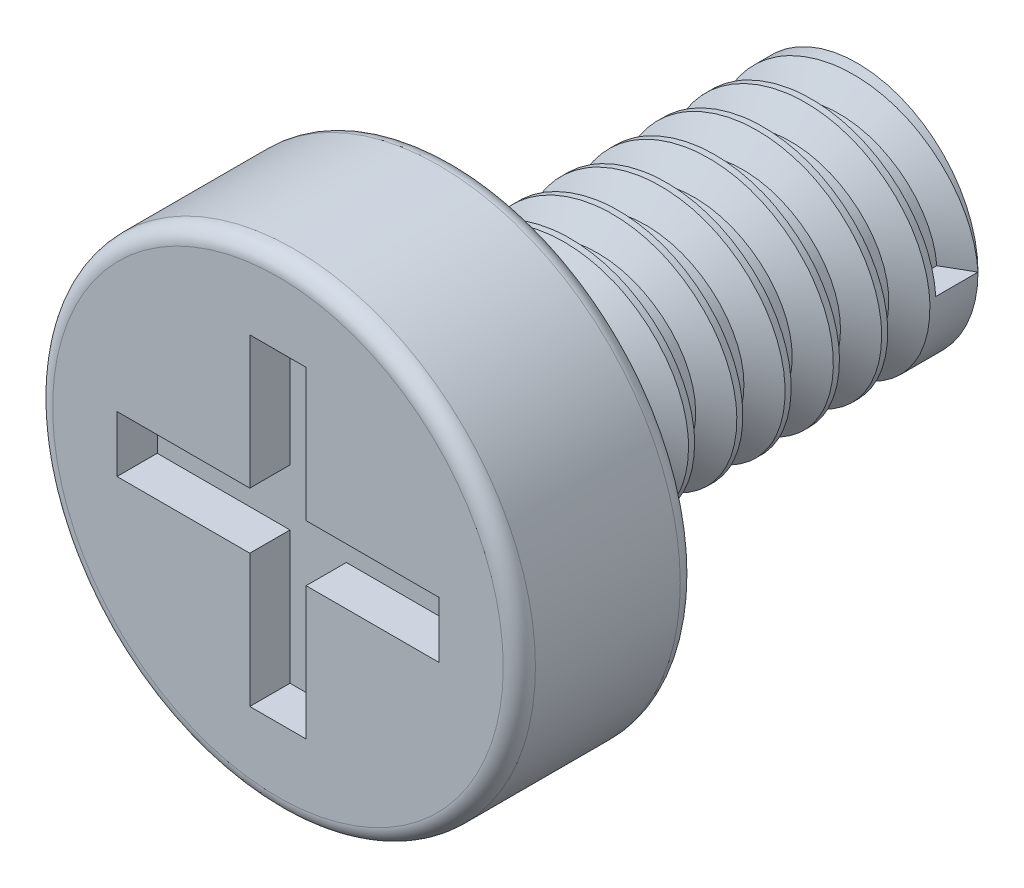
from build123d import *

# Parameters (mm, degrees)
SKETCH1_R           = 1.5
BOSS_EXTRUDE1_DEPTH = 5
SKETCH2_R           = 3
BOSS_EXTRUDE2_DEPTH = 2.2
SKETCH7_W           = 0.7
SKETCH7_H           = 1.65
SKETCH7_W_2         = 1.65
SKETCH7_H_2         = 0.7
CUT_EXTRUDE1_DEPTH  = 0.5
FILLET1_R           = 0.2
THREAD1_PITCH       = 0.6


with BuildPart() as part:
    # Sketch1 → Boss-Extrude1 (new body)
    with BuildSketch(Plane.XY):
        Circle(SKETCH1_R)
    extrude(amount=BOSS_EXTRUDE1_DEPTH)

    # Sketch2 → Boss-Extrude2 (add)
    with BuildSketch(Plane.XY.offset(5)):
        Circle(SKETCH2_R)
    extrude(amount=BOSS_EXTRUDE2_DEPTH)

    # Sketch7 → Cut-Extrude1 (cut)
    with BuildSketch(Plane.XY.offset(7.2)):
        with Locations((0, 1.175)):
            Rectangle(SKETCH7_W, SKETCH7_H)
        with Locations((1.175, 0)):
            Rectangle(SKETCH7_W_2, SKETCH7_H_2)
        with Locations((0, -1.175)):
            Rectangle(SKETCH7_W, SKETCH7_H)
        with Locations((-1.175, 0)):
            Rectangle(SKETCH7_W_2, SKETCH7_H_2)
        Rectangle(SKETCH7_W, SKETCH7_H_2)
    extrude(amount=-CUT_EXTRUDE1_DEPTH, mode=Mode.SUBTRACT)

    # Fillet1
    fillet1_edges = [part.edges().sort_by_distance(p)[0] for p in [
        (-3, 0, 5),
        (-3, 0, 7.2),
    ]]
    fillet(fillet1_edges, radius=FILLET1_R)

    # Thread1: the profile of Thread Profile1 profile screwed along a right-hand helix of 8.333333 turns, 6 arcs to a turn; built about Z, then put on its axis
    thread1_z = Axis((0, 0, 0), (0, 0, 1))
    thread1_corners = [(1.5003, 0, -0.000173205), (1.5003, 0, 0.525173203), (1.175240475, 0, 0.337499999), (1.175240475, 0, 0.187499999)]
    with BuildLine(mode=Mode.PRIVATE) as thread1_profile:
        Line(thread1_corners[0], thread1_corners[1])
        Line(thread1_corners[1], thread1_corners[2])
        Line(thread1_corners[2], thread1_corners[3])
        Line(thread1_corners[3], thread1_corners[0])
    thread1_cap = Face(thread1_profile.wire())
    thread1_turn_angles = [0, 30, 60, 90, 120, 150, 180, 210, 240, 270, 300, 330, 360]
    thread1_turn_weights = [1, 0.8660254037844387, 1, 0.8660254037844387, 1, 0.8660254037844387, 1, 0.8660254037844387, 1, 0.8660254037844387, 1, 0.8660254037844387, 1]
    thread1_turn_rails = [Edge.make_bspline([Vector(p[0], p[1], 0).rotate(thread1_z, thread1_turn_angles[k]) / thread1_turn_weights[k] + Vector(0, 0, p[2] + THREAD1_PITCH * thread1_turn_angles[k] / 360) for k in range(13)], [0, 0, 0, 1, 1, 2, 2, 3, 3, 4, 4, 5, 5, 6, 6, 6], 2, thread1_turn_weights) for p in thread1_corners]
    thread1_turn_sides = [Face.make_surface_from_curves(thread1_turn_rails[p[0]], thread1_turn_rails[p[1]]) for p in [(0, 1), (1, 2), (2, 3), (3, 0)]]
    thread1_last_angles = [2880, 2910, 2940, 2970, 3000]
    thread1_last_weights = [1, 0.8660254037844387, 1, 0.8660254037844387, 1]
    thread1_last_rails = [Edge.make_bspline([Vector(p[0], p[1], 0).rotate(thread1_z, thread1_last_angles[k]) / thread1_last_weights[k] + Vector(0, 0, p[2] + THREAD1_PITCH * thread1_last_angles[k] / 360) for k in range(5)], [0, 0, 0, 1, 1, 2, 2, 2], 2, thread1_last_weights) for p in thread1_corners]
    thread1_last_sides = [Face.make_surface_from_curves(thread1_last_rails[p[0]], thread1_last_rails[p[1]]) for p in [(0, 1), (1, 2), (2, 3), (3, 0)]]
    thread1 = Plane(origin=(0, 0, 0), x_dir=(1, 0, 0), z_dir=(0, 0, 1)) * Solid(Shell([*[p.moved(Location((0, 0, THREAD1_PITCH * i))) for i in range(8) for p in thread1_turn_sides], *thread1_last_sides, thread1_cap, thread1_cap.rotate(thread1_z, 3000).moved(Location((0, 0, THREAD1_PITCH * 3000 / 360)))]))
    add(thread1, mode=Mode.SUBTRACT)


solid = part.part
